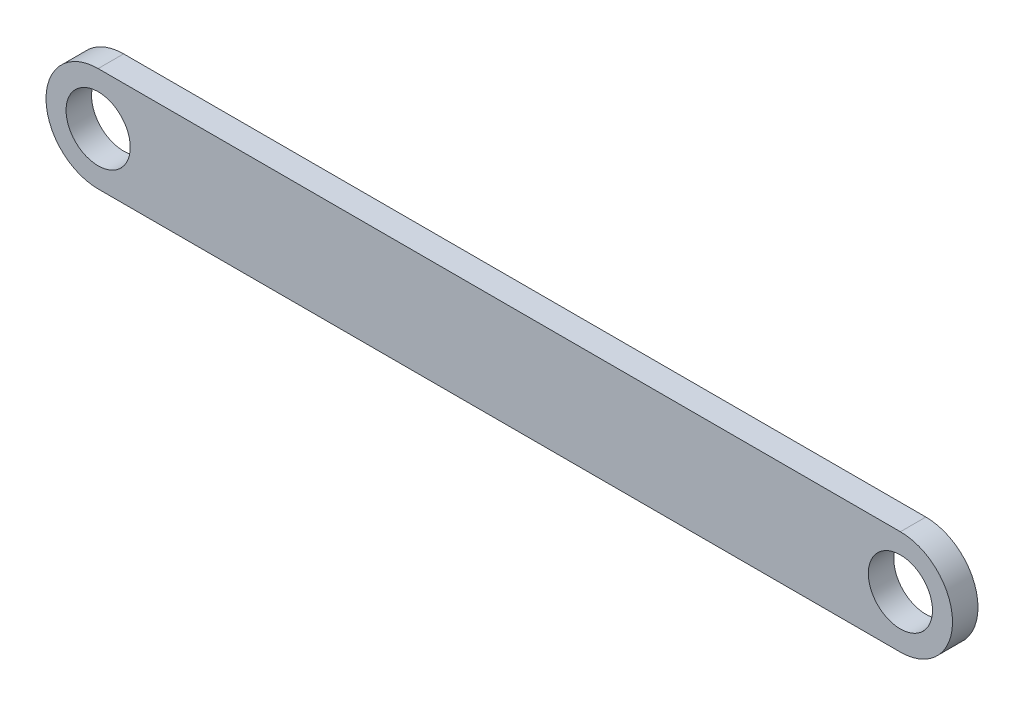
from build123d import *

# Parameters (mm, degrees)
SKETCH1_R           = 4
BOSS_EXTRUDE1_DEPTH = 3.175


with BuildPart() as part:
    # Sketch1 → Boss-Extrude1 (new body)
    with BuildSketch(Plane.XY):
        with BuildLine():
            Line((-50, 6.5), (50, 6.5))
            ThreePointArc((50, 6.5), (56.5, 0), (50, -6.5))
            Line((50, -6.5), (-50, -6.5))
            ThreePointArc((-50, -6.5), (-56.5, 0), (-50, 6.5))
        make_face()
        with Locations((-50, 0)):
            Circle(SKETCH1_R, mode=Mode.SUBTRACT)
        with Locations((50, 0)):
            Circle(SKETCH1_R, mode=Mode.SUBTRACT)
    extrude(amount=BOSS_EXTRUDE1_DEPTH)


solid = part.part
